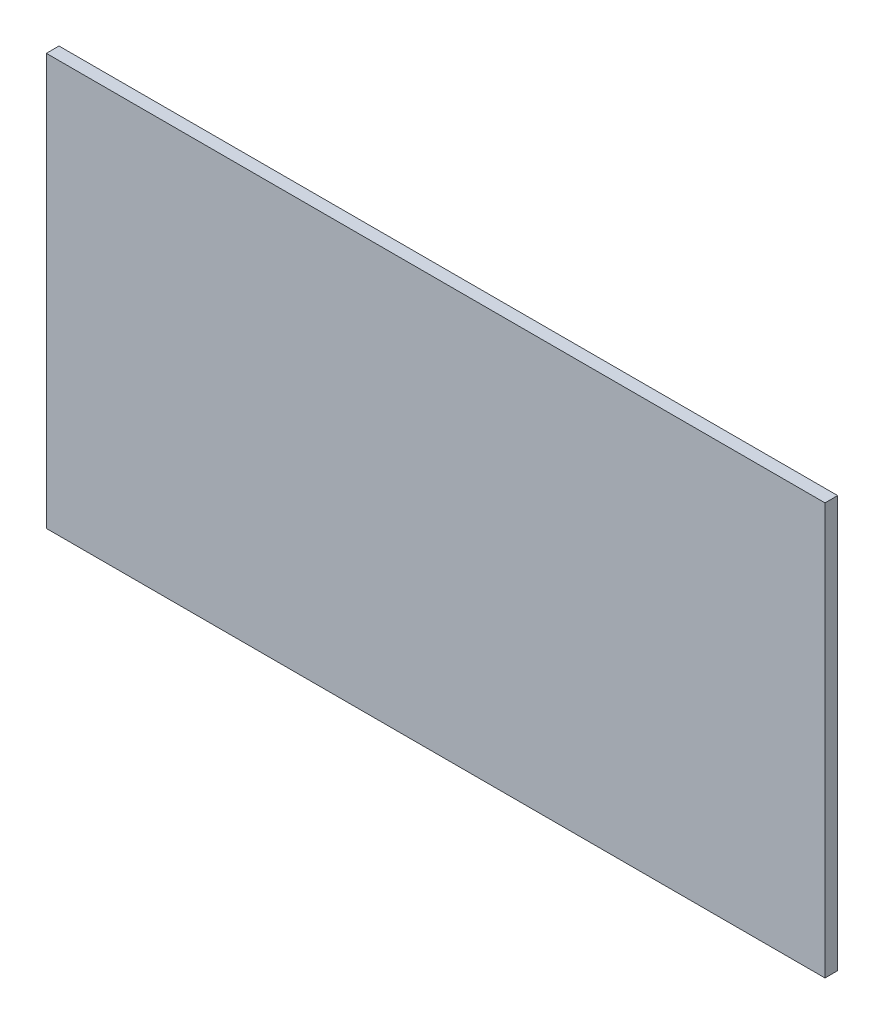
from build123d import *

# Parameters (mm, degrees)
SKETCH_1_W      = 369
SKETCH_1_H      = 195
EXTRUDE_1_DEPTH = 6


with BuildPart() as part:
    # Эскиз1 → Бобышка-Вытянуть1 (new body)
    with BuildSketch(Plane.XY):
        with Locations((300, 145.5)):
            Rectangle(SKETCH_1_W, SKETCH_1_H)
    extrude(amount=EXTRUDE_1_DEPTH)


solid = part.part
